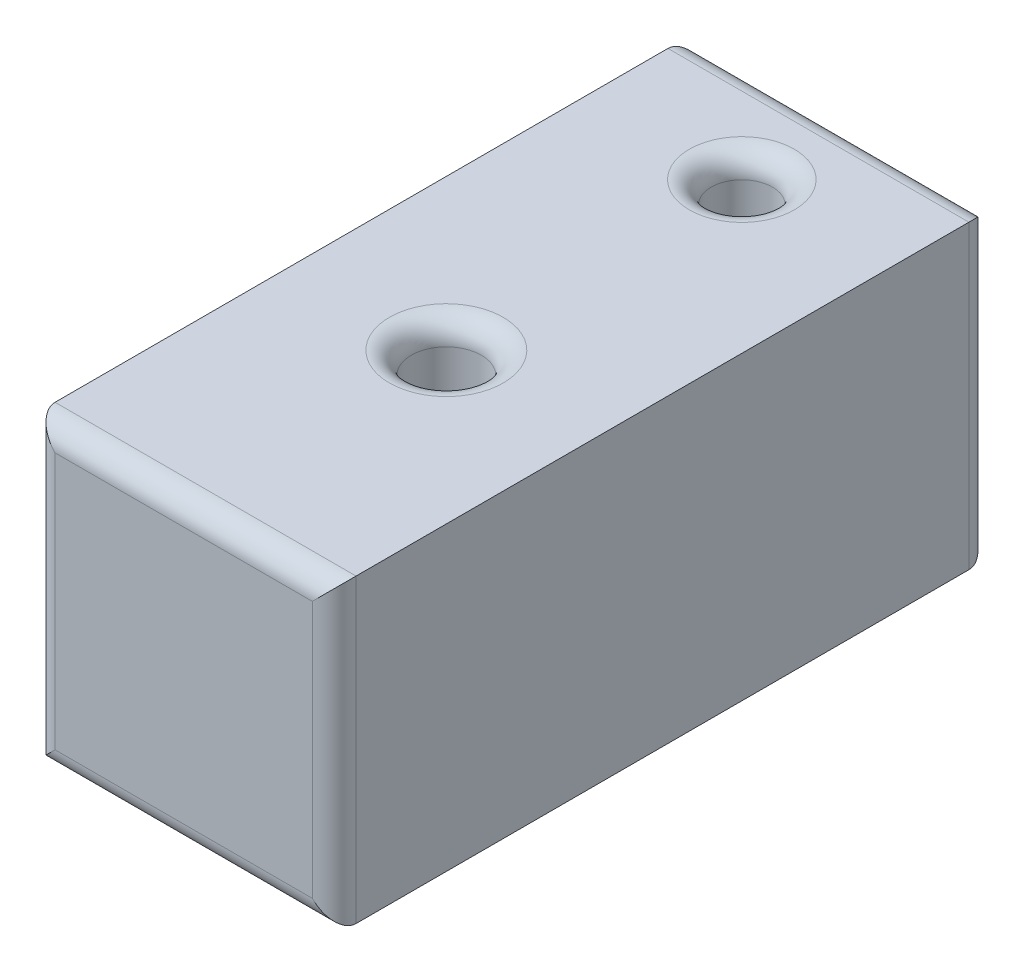
from build123d import *

# Parameters (mm, degrees)
BOSS_EXTRUDE1_DEPTH      = 12
BOSS_EXTRUDE1_DEPTH_BACK = 18
SKETCH1_W                = 13.75
SKETCH1_H                = 13.75
CUT_EXTRUDE1_DEPTH       = 21.458036318
CUT_EXTRUDE1_DEPTH_BACK  = 21.458036318
SKETCH2_R                = 1.6
SKETCH2_R_2              = 1.4
FILLET1_R                = 1
FILLET2_R                = 1


with BuildPart() as part:
    # Sketch1 → Boss-Extrude1 (new, two sides: drawn at the far end of the back side and taken through both)
    with BuildSketch(Plane.XY.offset(-BOSS_EXTRUDE1_DEPTH_BACK)):
        Rectangle(SKETCH1_W, SKETCH1_H)
    extrude(amount=BOSS_EXTRUDE1_DEPTH + BOSS_EXTRUDE1_DEPTH_BACK)

    # Sketch2 → Cut-Extrude1 (cut, two sides: drawn at the far end of the back side and taken through both)
    with BuildSketch(Plane(origin=(0, 0, 0), x_dir=(1, 0, 0), z_dir=(0, 1, 0)).offset(-CUT_EXTRUDE1_DEPTH_BACK)):
        Circle(SKETCH2_R)
        with Locations((0, 13.5)):
            Circle(SKETCH2_R_2)
    extrude(amount=CUT_EXTRUDE1_DEPTH + CUT_EXTRUDE1_DEPTH_BACK, mode=Mode.SUBTRACT)

    # Fillet1
    fillet1_edges = [part.edges().sort_by_distance(p)[0] for p in [
        (0, 6.875, -18),
        (-6.875, 0, -18),
        (0, -6.875, -18),
        (6.875, 0, -18),
        (0, -6.875, 12),
        (-6.875, 0, 12),
        (0, 6.875, 12),
        (6.875, 0, 12),
    ]]
    fillet(fillet1_edges, radius=FILLET1_R)

    # Fillet2
    fillet2_edges = [part.edges().sort_by_distance(p)[0] for p in [
        (-1.4, 6.875, -13.5),
        (-1.4, -6.875, -13.5),
        (-1.6, -6.875, 0),
        (-1.6, 6.875, 0),
    ]]
    fillet(fillet2_edges, radius=FILLET2_R)


solid = part.part
